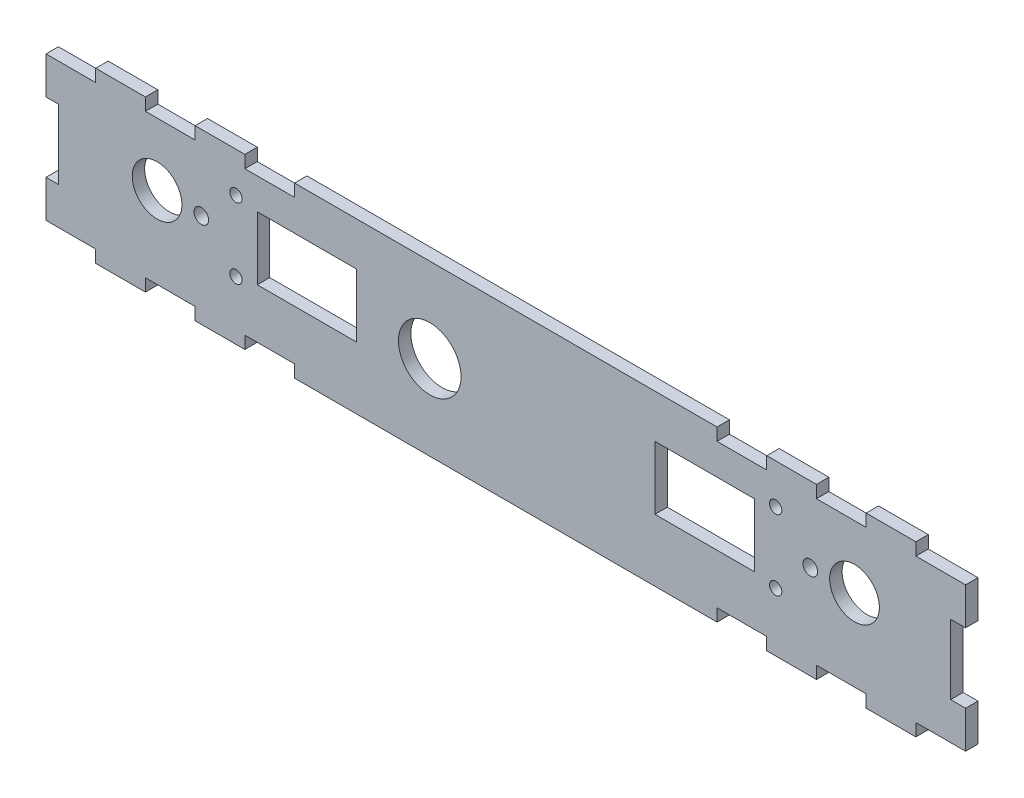
from build123d import *

# Parameters (mm, degrees)
SKETCH3_W           = 234.95
SKETCH3_H           = 30.48
SKETCH3_W_2         = 25.4
SKETCH3_H_2         = 16.15
SKETCH3_R           = 1.574999898
SKETCH3_R_2         = 1.875
SKETCH3_R_3         = 6.35
BOSS_EXTRUDE1_DEPTH = 3.175
BOSS_EXTRUDE2_DEPTH = 3.175
SKETCH5_W           = 3.175
SKETCH5_H           = 17.78
SKETCH5_W_2         = 3.81
CUT_EXTRUDE1_DEPTH  = 7.62
SKETCH6_R           = 8
CUT_EXTRUDE2_DEPTH  = 5.08


with BuildPart() as part:
    # Sketch3 → Boss-Extrude1 (new body)
    with BuildSketch(Plane.XY):
        with Locations((-63.5, 8.8475)):
            Rectangle(SKETCH3_W, SKETCH3_H)
        with Locations((-12.7, 11.25)):
            Rectangle(SKETCH3_W_2, SKETCH3_H_2, mode=Mode.SUBTRACT)
        with Locations((5.45, 2.250000072)):
            Circle(SKETCH3_R, mode=Mode.SUBTRACT)
        with Locations((14.3, 11.25)):
            Circle(SKETCH3_R_2, mode=Mode.SUBTRACT)
        with Locations((25.6, 11.25)):
            Circle(SKETCH3_R_3, mode=Mode.SUBTRACT)
        with Locations((5.45, 20.25)):
            Circle(SKETCH3_R, mode=Mode.SUBTRACT)
        with Locations((-114.3, 11.25)):
            Rectangle(SKETCH3_W_2, SKETCH3_H_2, mode=Mode.SUBTRACT)
        with Locations((-152.6, 11.25)):
            Circle(SKETCH3_R_3, mode=Mode.SUBTRACT)
        with Locations((-141.3, 11.25)):
            Circle(SKETCH3_R_2, mode=Mode.SUBTRACT)
        with Locations((-132.45, 20.25)):
            Circle(SKETCH3_R, mode=Mode.SUBTRACT)
        with Locations((-132.45, 2.250000072)):
            Circle(SKETCH3_R, mode=Mode.SUBTRACT)
    extrude(amount=BOSS_EXTRUDE1_DEPTH)

    # Sketch4 → Boss-Extrude2 (add)
    with BuildSketch(Plane.XY.offset(3.175)):
        Polygon((-155.575, 27.2625), (-155.575, 30.4375), (-168.275, 30.4375), (-168.275, 27.2625), (-180.975, 27.2625), (-180.975, 24.0875), (53.975, 24.0875), (53.975, 27.2625), (41.275, 27.2625), (41.275, 30.4375), (28.575, 30.4375), (28.575, 27.2625), (15.875, 27.2625), (15.875, 30.4375), (3.175, 30.4375), (3.175, 27.2625), (-9.525, 27.2625), (-9.525, 30.4375), (-117.475, 30.4375), (-117.475, 27.2625), (-130.175, 27.2625), (-130.175, 30.4375), (-142.875, 30.4375), (-142.875, 27.2625), align=None)
        Polygon((53.975, -6.3925), (-180.975, -6.3925), (-180.975, -9.5675), (-168.275, -9.5675), (-168.275, -12.7425), (-155.575, -12.7425), (-155.575, -9.5675), (-142.875, -9.5675), (-142.875, -12.7425), (-130.175, -12.7425), (-130.175, -9.5675), (-117.475, -9.5675), (-117.475, -12.7425), (-9.525, -12.7425), (-9.525, -9.5675), (3.175, -9.5675), (3.175, -12.7425), (15.875, -12.7425), (15.875, -9.5675), (28.575, -9.5675), (28.575, -12.7425), (41.275, -12.7425), (41.275, -9.5675), (53.975, -9.5675), align=None)
    extrude(amount=-BOSS_EXTRUDE2_DEPTH)

    # Sketch5 → Cut-Extrude1 (cut)
    with BuildSketch(Plane.XY.offset(3.175)):
        with Locations((-179.3875, 8.8475)):
            Rectangle(SKETCH5_W, SKETCH5_H)
        with Locations((52.07, 8.8475)):
            Rectangle(SKETCH5_W_2, SKETCH5_H)
    extrude(amount=-CUT_EXTRUDE1_DEPTH, mode=Mode.SUBTRACT)

    # Sketch6 → Cut-Extrude2 (cut)
    with BuildSketch(Plane(origin=(0, 0, 0), x_dir=(-1, 0, 0), z_dir=(0, 0, -1))):
        with Locations((82.931, 8.8475)):
            Circle(SKETCH6_R)
    extrude(amount=-CUT_EXTRUDE2_DEPTH, mode=Mode.SUBTRACT)


solid = part.part
